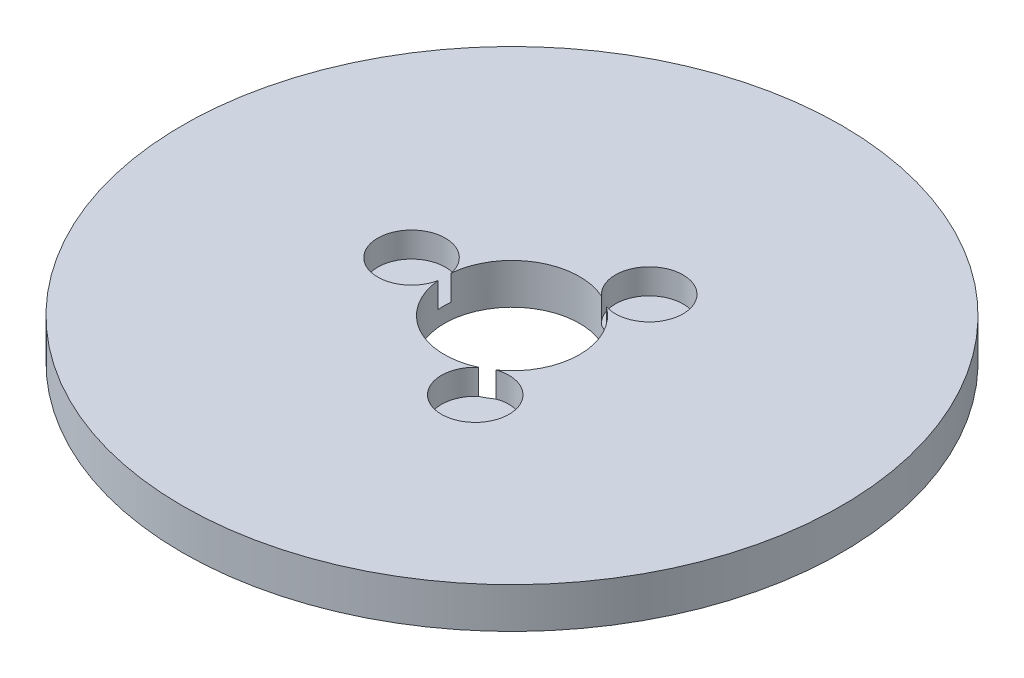
from build123d import *

# Parameters (mm, degrees)
SKETCH1_R           = 97.5
BOSS_EXTRUDE1_DEPTH = 12
SKETCH2_R           = 20
CUT_EXTRUDE1_DEPTH  = 139.407008493
SKETCH3_R           = 10
CUT_EXTRUDE2_DEPTH  = 7.448022219
CIRPATTERN1_COUNT   = 3


with BuildPart() as part:
    # Sketch1 → Boss-Extrude1 (new body)
    with BuildSketch(Plane(origin=(0, 0, 0), x_dir=(1, 0, 0), z_dir=(0, 1, 0))):
        Circle(SKETCH1_R)
    extrude(amount=BOSS_EXTRUDE1_DEPTH)

    # Sketch2 → Cut-Extrude1 (cut, through all)
    with BuildSketch(Plane(origin=(0, 0, 0), x_dir=(1, 0, 0), z_dir=(0, 1, 0))):
        Circle(SKETCH2_R)
    extrude(amount=CUT_EXTRUDE1_DEPTH, mode=Mode.SUBTRACT)

    # Sketch3 → Cut-Extrude2 (cut)
    with BuildSketch(Plane(origin=(0, 12, 0), x_dir=(1, 0, 0), z_dir=(0, 1, 0))):
        with Locations((-29.72284232, 0)):
            Circle(SKETCH3_R)
    cut_extrude2 = extrude(amount=-CUT_EXTRUDE2_DEPTH, mode=Mode.SUBTRACT)

    # CirPattern1: Cut-Extrude2 ×3 about axis
    cirpattern1_axis = Axis((0, 0, 0), (0, 1, 0))
    for i in range(1, CIRPATTERN1_COUNT):
        add(cut_extrude2.rotate(cirpattern1_axis, i * 360 / CIRPATTERN1_COUNT), mode=Mode.SUBTRACT)


solid = part.part
